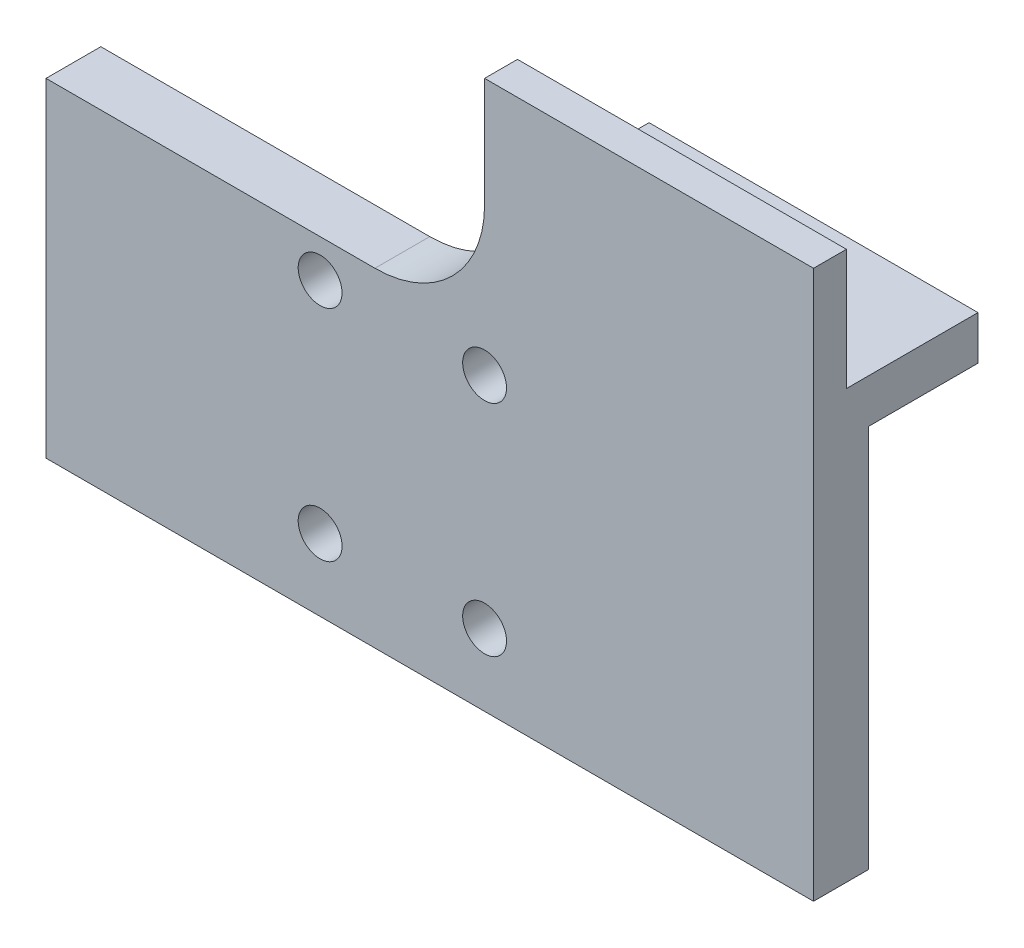
from build123d import *

# Parameters (mm, degrees)
BODY_DEPTH          = 5
SKETCH2_R           = 2
CUT_EXTRUDE1_DEPTH  = 87.168439698
LPATTERN1_COUNT     = 2
LPATTERN1_PITCH     = 20
SKETCH4_W           = 30
SKETCH4_H           = 2
CUT_EXTRUDE2_DEPTH  = 12
SKETCH5_W           = 30
SKETCH5_H           = 1
BOSS_EXTRUDE3_DEPTH = 12
SKETCH6_W           = 30
SKETCH6_H           = 10
BOSS_EXTRUDE4_DEPTH = 3


with BuildPart() as part:
    # Sketch1 → Body (new body)
    with BuildSketch(Plane.XY):
        with BuildLine():
            Line((0, 0), (70, 0))
            Line((70, 0), (70, 50))
            Line((70, 50), (40, 50))
            Line((40, 50), (40, 40))
            ThreePointArc((40, 40), (37.071067812, 32.928932188), (30, 30))
            Line((30, 30), (0, 30))
            Line((0, 30), (0, 0))
        make_face()
    extrude(amount=BODY_DEPTH)

    # Sketch2 → Cut-Extrude1 (cut, through all)
    with BuildSketch(Plane.XY.offset(5)):
        with Locations((25, 6.55)):
            Circle(SKETCH2_R)
        with Locations((40, 6.55)):
            Circle(SKETCH2_R)
    cut_extrude1 = extrude(amount=-CUT_EXTRUDE1_DEPTH, mode=Mode.SUBTRACT)

    # LPattern1: Cut-Extrude1 ×2
    with Locations(*[(0, i * LPATTERN1_PITCH, 0) for i in range(1, LPATTERN1_COUNT)]):
        add(cut_extrude1, mode=Mode.SUBTRACT)

    # Sketch4 → Cut-Extrude2 (cut)
    with BuildSketch(Plane(origin=(0, 50, 0), x_dir=(1, 0, 0), z_dir=(0, 1, 0))):
        with Locations((55, -1)):
            Rectangle(SKETCH4_W, SKETCH4_H)
    extrude(amount=-CUT_EXTRUDE2_DEPTH, mode=Mode.SUBTRACT)

    # Sketch5 → Boss-Extrude3 (add)
    with BuildSketch(Plane(origin=(0, 0, 2), x_dir=(-1, 0, 0), z_dir=(0, 0, -1))):
        with Locations((-55, 38.5)):
            Rectangle(SKETCH5_W, SKETCH5_H)
    extrude(amount=BOSS_EXTRUDE3_DEPTH)

    # Sketch6 → Boss-Extrude4 (add)
    with BuildSketch(Plane.XZ.offset(-38)):
        with Locations((55, -5)):
            Rectangle(SKETCH6_W, SKETCH6_H)
    extrude(amount=BOSS_EXTRUDE4_DEPTH)


solid = part.part
